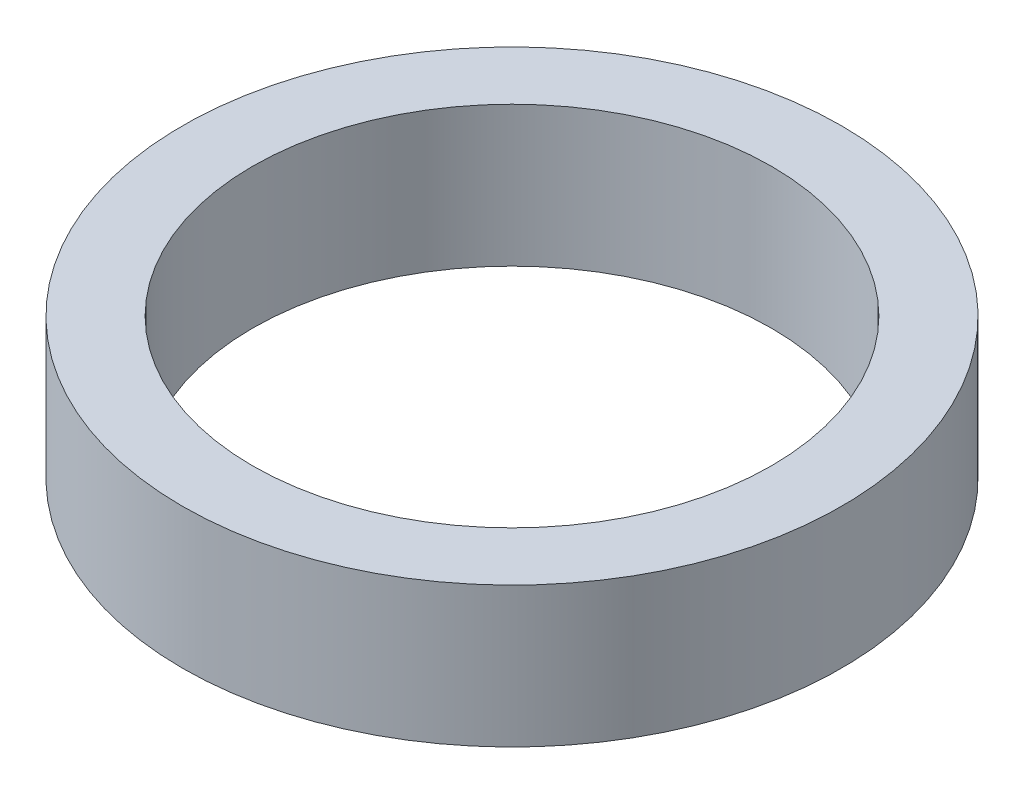
from build123d import *

# Parameters (mm, degrees)
SKETCH1_R           = 29.845
SKETCH1_R_2         = 23.495
BOSS_EXTRUDE2_DEPTH = 12.7


with BuildPart() as part:
    # Sketch1 → Boss-Extrude2 (new body)
    with BuildSketch(Plane(origin=(0, 0, 0), x_dir=(1, 0, 0), z_dir=(0, 1, 0))):
        Circle(SKETCH1_R)
        Circle(SKETCH1_R_2, mode=Mode.SUBTRACT)
    extrude(amount=BOSS_EXTRUDE2_DEPTH)

    # Sketch2 → Cut-Revolve1 (revolve, cut)
    with BuildSketch(Plane(origin=(0, 0, 0), x_dir=(0, 0, -1), z_dir=(1, 0, 0))):
        with BuildLine():
            Line((-29.780851973, 0), (-23.559148027, 0))
            ThreePointArc((-23.559148027, 0), (-26.67, 2.54), (-29.780851973, 0))
        make_face()
    revolve(axis=Axis((0, 0, 0), (0, 1, 0)), mode=Mode.SUBTRACT)


solid = part.part
